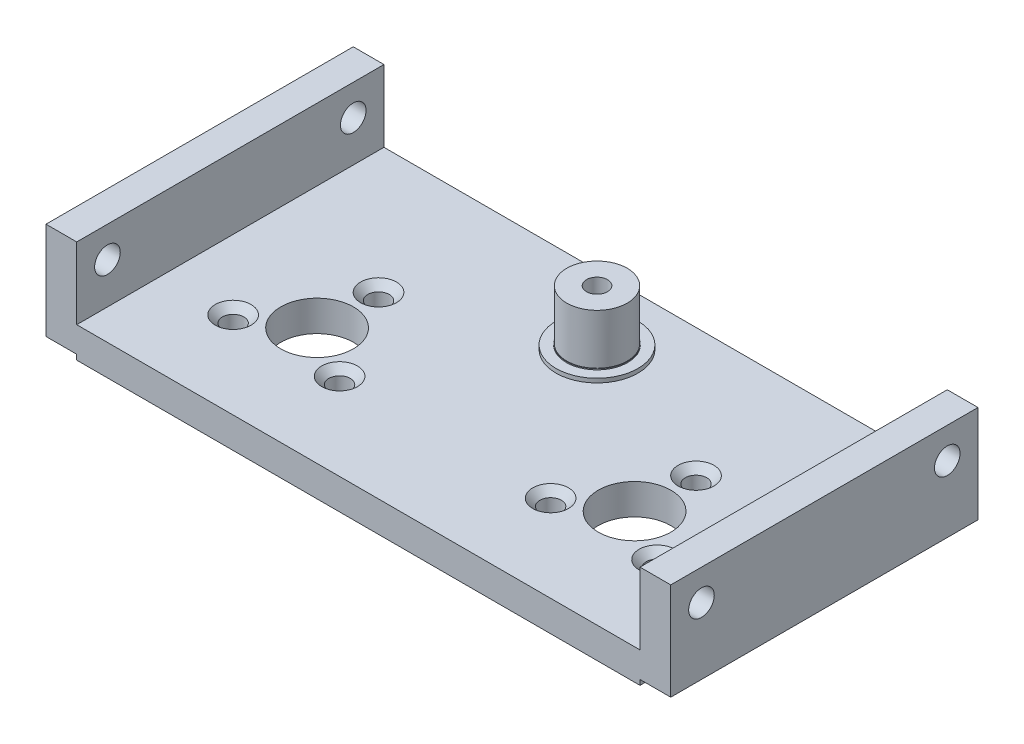
from build123d import *
from build123d.topology import SkipClean

# Parameters (mm, degrees)
SKETCH1_W                                       = 55
SKETCH1_H                                       = 30
BOSS_EXTRUDE1_DEPTH                             = 3
SKETCH2_R                                       = 2.95
BOSS_EXTRUDE2_DEPTH                             = 4.9
SKETCH8_R                                       = 3.55
CUT_EXTRUDE2_DEPTH                              = 6
BOSS_EXTRUDE3_DEPTH                             = 6.5
BOSS_EXTRUDE3_DEPTH_BACK                        = 3
SKETCH10_W                                      = 3
SKETCH10_H                                      = 30
BOSS_EXTRUDE4_DEPTH                             = 6.5
BOSS_EXTRUDE4_DEPTH_BACK                        = 3
SKETCH11_W                                      = 3
SKETCH11_H                                      = 30
TAP_DRILL_FOR_M3X0_5_TAP1_AT_2_COUNT            = 2
TAP_DRILL_FOR_M3X0_5_TAP1_AT_2_PITCH            = 24
TAP_DRILL_FOR_M2_5X0_45_TAP2_D                  = 2.05
TAP_DRILL_FOR_M2_5X0_45_TAP2_DEPTH              = 6
TAP_DRILL_FOR_M2_5X0_45_TAP2_TIP                = 0.615882135
SKETCH18_R                                      = 1.05
CUT_EXTRUDE4_DEPTH                              = 10
CIRPATTERN2_COUNT                               = 3
MIRROR3_COPY_1_SKETCH_R                         = 1.05
MIRROR3_COPY_1_DEPTH                            = 10
MIRROR3_COPY_2_SKETCH_R                         = 1.05
MIRROR3_COPY_2_DEPTH                            = 10
SKETCH21_W                                      = 55
SKETCH21_H                                      = 30
SKETCH21_R                                      = 4
CUT_EXTRUDE7_DEPTH                              = 0.5
SKETCH23_R                                      = 4
SKETCH23_R_2                                    = 3
CUT_EXTRUDE8_DEPTH                              = 0.1
CSK_FOR_M2_FLAT_HEAD_MACHINE_SCREW1_D           = 2.1
CSK_FOR_M2_FLAT_HEAD_MACHINE_SCREW1_DEPTH       = 9.5
CSK_FOR_M2_FLAT_HEAD_MACHINE_SCREW1_CSINK_D     = 3.5
CSK_FOR_M2_FLAT_HEAD_MACHINE_SCREW1_CSINK_ANGLE = 90
CSK_FOR_M2_FLAT_HEAD_MACHINE_SCREW1_TIP         = 0.63090365
SKETCH25_W                                      = 55
SKETCH25_H                                      = 30
SKETCH25_R                                      = 3.55
SKETCH25_R_2                                    = 1.05
BOSS_EXTRUDE6_DEPTH                             = 0.5


with BuildPart() as part:
    # Sketch1 → Boss-Extrude1 (new body)
    with BuildSketch(Plane(origin=(0, 0, 0), x_dir=(1, 0, 0), z_dir=(0, 1, 0))):
        with Locations((27.5, 16)):
            Rectangle(SKETCH1_W, SKETCH1_H)
    extrude(amount=BOSS_EXTRUDE1_DEPTH)

    # Sketch2 → Boss-Extrude2 (add)
    with BuildSketch(Plane(origin=(0, 3, 0), x_dir=(1, 0, 0), z_dir=(0, 1, 0))):
        with Locations((27.5, 24.3)):
            Circle(SKETCH2_R)
    extrude(amount=BOSS_EXTRUDE2_DEPTH)

    # Sketch8 → Cut-Extrude2 (cut)
    with BuildSketch(Plane(origin=(0, 3, 0), x_dir=(1, 0, 0), z_dir=(0, 1, 0))):
        with Locations((43, 12.467840434)):
            Circle(SKETCH8_R)
    cut_extrude2 = extrude(amount=-CUT_EXTRUDE2_DEPTH, mode=Mode.SUBTRACT)

    # Mirror1: Cut-Extrude2 across plane
    add(cut_extrude2.mirror(Plane(origin=(27.5, 0, 0), x_dir=(0, 0, 1), z_dir=(1, 0, 0))), mode=Mode.SUBTRACT)

    # Sketch10 → Boss-Extrude3 (add, two sides: drawn at the far end of the back side and taken through both)
    with BuildSketch(Plane(origin=(0, 3, 0), x_dir=(1, 0, 0), z_dir=(0, 1, 0)).offset(-BOSS_EXTRUDE3_DEPTH_BACK)):
        with Locations((56.5, 16)):
            Rectangle(SKETCH10_W, SKETCH10_H)
    extrude(amount=BOSS_EXTRUDE3_DEPTH + BOSS_EXTRUDE3_DEPTH_BACK)

    # Sketch11 → Boss-Extrude4 (add, two sides: drawn at the far end of the back side and taken through both)
    with BuildSketch(Plane(origin=(0, 3, 0), x_dir=(1, 0, 0), z_dir=(0, 1, 0)).offset(-BOSS_EXTRUDE4_DEPTH_BACK)):
        with Locations((-1.5, 16)):
            Rectangle(SKETCH11_W, SKETCH11_H)
    extrude(amount=BOSS_EXTRUDE4_DEPTH + BOSS_EXTRUDE4_DEPTH_BACK)

    # Sketch12 → Tap Drill for M3x0.5 Tap1 (revolve, cut)
    with BuildSketch(Plane(origin=(-3, 6.5, -28), x_dir=(0, 0, 1), z_dir=(0, 1, 0))):
        Polygon((0, 0), (0, 10.751075774), (1.25, 10), (1.25, 0), align=None)
    tap_drill_for_m3x0_5_tap1 = revolve(axis=Axis((-9.35, 6.5, -28), (1, 0, 0)), mode=Mode.SUBTRACT)

    # Tap Drill for M3x0.5 Tap1 at 2: Tap Drill for M3x0.5 Tap1 ×2
    with Locations(*[(0, 0, i * TAP_DRILL_FOR_M3X0_5_TAP1_AT_2_PITCH) for i in range(1, TAP_DRILL_FOR_M3X0_5_TAP1_AT_2_COUNT)]):
        add(tap_drill_for_m3x0_5_tap1, mode=Mode.SUBTRACT)

    # Mirror2: Tap Drill for M3x0.5 Tap1 across plane
    add(tap_drill_for_m3x0_5_tap1.mirror(Plane(origin=(27.5, 0, 0), x_dir=(0, 0, 1), z_dir=(1, 0, 0))), mode=Mode.SUBTRACT)

    # Mirror2 copy 1 sketch → Mirror2 copy 1 (revolve, cut)
    with BuildSketch(Plane(origin=(58, 6.5, -4), x_dir=(0, 0, 1), z_dir=(0, 1, 0))):
        Polygon((0, 0), (0, -10.751075774), (1.25, -10), (1.25, 0), align=None)
    revolve(axis=Axis((64.35, 6.5, -4), (1, 0, 0)), mode=Mode.SUBTRACT)

    # Tap Drill for M2.5x0.45 Tap2
    with Locations(Plane(origin=(0, 7.9, 0), x_dir=(1, 0, 0), z_dir=(0, 1, 0))):
        with Locations((27.5, 24.3)):
            Hole(TAP_DRILL_FOR_M2_5X0_45_TAP2_D / 2, depth=TAP_DRILL_FOR_M2_5X0_45_TAP2_DEPTH)
            with Locations((0, 0, -(TAP_DRILL_FOR_M2_5X0_45_TAP2_DEPTH + TAP_DRILL_FOR_M2_5X0_45_TAP2_TIP / 2))):  # 118° drill point
                Cone(0, TAP_DRILL_FOR_M2_5X0_45_TAP2_D / 2, TAP_DRILL_FOR_M2_5X0_45_TAP2_TIP, mode=Mode.SUBTRACT)

    # Sketch18 → Cut-Extrude4 (cut)
    with BuildSketch(Plane(origin=(0, 3, 0), x_dir=(1, 0, 0), z_dir=(0, 1, 0))):
        with Locations((12, 18.467840434)):
            Circle(SKETCH18_R)
    cut_extrude4 = extrude(amount=-CUT_EXTRUDE4_DEPTH, mode=Mode.SUBTRACT)

    # CirPattern2: Cut-Extrude4 ×3 about axis
    cirpattern2_axis = Axis((12, -3, -12.467840434), (0, 1, 0))
    for i in range(1, CIRPATTERN2_COUNT):
        add(cut_extrude4.rotate(cirpattern2_axis, i * 360 / CIRPATTERN2_COUNT), mode=Mode.SUBTRACT)

    # Mirror3: Cut-Extrude4 across plane
    add(cut_extrude4.mirror(Plane(origin=(27.5, 0, 0), x_dir=(0, 0, 1), z_dir=(1, 0, 0))), mode=Mode.SUBTRACT)

    # Mirror3 copy 1 sketch → Mirror3 copy 1 (cut)
    with BuildSketch(Plane(origin=(26.202533454, 3, -8.309455805), x_dir=(0.4999999999999998, 0, -0.8660254037844387), z_dir=(0, 1, 0))):
        with Locations((12, -18.467840434)):
            Circle(MIRROR3_COPY_1_SKETCH_R)
    extrude(amount=-MIRROR3_COPY_1_DEPTH, mode=Mode.SUBTRACT)

    # Mirror3 copy 2 sketch → Mirror3 copy 2 (cut)
    with BuildSketch(Plane(origin=(47.797466546, 3, -29.094065496), x_dir=(0.5000000000000004, 0, 0.8660254037844384), z_dir=(0, 1, 0))):
        with Locations((12, -18.467840434)):
            Circle(MIRROR3_COPY_2_SKETCH_R)
    extrude(amount=-MIRROR3_COPY_2_DEPTH, mode=Mode.SUBTRACT)

    # Sketch21 → Cut-Extrude7 (cut)
    with BuildSketch(Plane(origin=(0, 3, 0), x_dir=(1, 0, 0), z_dir=(0, 1, 0))):
        with Locations((27.5, 16)):
            Rectangle(SKETCH21_W, SKETCH21_H)
        with Locations((27.5, 24.3)):
            Circle(SKETCH21_R, mode=Mode.SUBTRACT)
    extrude(amount=-CUT_EXTRUDE7_DEPTH, mode=Mode.SUBTRACT)

    # Sketch23 → Cut-Extrude8 (cut)
    with BuildSketch(Plane(origin=(0, 3, 0), x_dir=(1, 0, 0), z_dir=(0, 1, 0))):
        with Locations((27.5, 24.3)):
            Circle(SKETCH23_R)
        with Locations((27.5, 24.3)):
            Circle(SKETCH23_R_2, mode=Mode.SUBTRACT)
    extrude(amount=-CUT_EXTRUDE8_DEPTH, mode=Mode.SUBTRACT)

    # CSK for M2 Flat Head Machine Screw1
    with Locations(Plane(origin=(43, 2.5, -18.467840434), x_dir=(0, 0, 1), z_dir=(0, 1, 0))):
        with Locations((0, 0), (9, 5.196152423), (9, -5.196152423), (9, -25.803847577), (0, -31), (9, -36.196152423)):
            CounterSinkHole(CSK_FOR_M2_FLAT_HEAD_MACHINE_SCREW1_D / 2, CSK_FOR_M2_FLAT_HEAD_MACHINE_SCREW1_CSINK_D / 2, depth=CSK_FOR_M2_FLAT_HEAD_MACHINE_SCREW1_DEPTH, counter_sink_angle=CSK_FOR_M2_FLAT_HEAD_MACHINE_SCREW1_CSINK_ANGLE)
            with Locations((0, 0, -(CSK_FOR_M2_FLAT_HEAD_MACHINE_SCREW1_DEPTH + CSK_FOR_M2_FLAT_HEAD_MACHINE_SCREW1_TIP / 2))):  # 118° drill point
                Cone(0, CSK_FOR_M2_FLAT_HEAD_MACHINE_SCREW1_D / 2, CSK_FOR_M2_FLAT_HEAD_MACHINE_SCREW1_TIP, mode=Mode.SUBTRACT)

    # Sketch25 → Boss-Extrude6 (add)
    with SkipClean():  # the faces are left unmerged after this step: merging them gives an invalid solid
        with BuildSketch(Plane(origin=(0, 0, 0), x_dir=(-1, 0, 0), z_dir=(0, -1, 0))):
            with Locations((-27.5, 16)):
                Rectangle(SKETCH25_W, SKETCH25_H)
            with Locations((-43, 12.467840434)):
                Circle(SKETCH25_R, mode=Mode.SUBTRACT)
            with Locations((-48.196152423, 9.467840434)):
                Circle(SKETCH25_R_2, mode=Mode.SUBTRACT)
            with Locations((-43, 18.467840434)):
                Circle(SKETCH25_R_2, mode=Mode.SUBTRACT)
            with Locations((-37.803847577, 9.467840434)):
                Circle(SKETCH25_R_2, mode=Mode.SUBTRACT)
            with Locations((-12, 12.467840434)):
                Circle(SKETCH25_R, mode=Mode.SUBTRACT)
            with Locations((-17.196152423, 9.467840434)):
                Circle(SKETCH25_R_2, mode=Mode.SUBTRACT)
            with Locations((-12, 18.467840434)):
                Circle(SKETCH25_R_2, mode=Mode.SUBTRACT)
            with Locations((-6.803847577, 9.467840434)):
                Circle(SKETCH25_R_2, mode=Mode.SUBTRACT)
        extrude(amount=BOSS_EXTRUDE6_DEPTH)


solid = part.part
